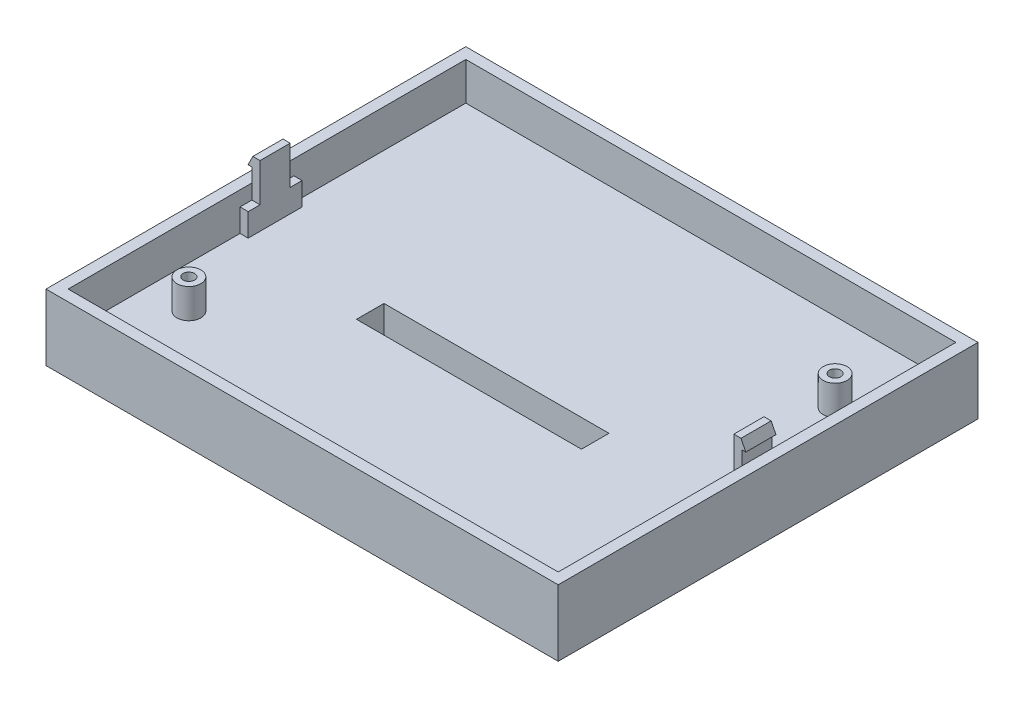
from build123d import *

# Parameters (mm, degrees)
SKETCH1_W           = 107
SKETCH1_H           = 87.7
BOSS_EXTRUDE1_DEPTH = 13.85
SKETCH2_W           = 102.38
SKETCH2_H           = 83.08
CUT_EXTRUDE1_DEPTH  = 7.9
SKETCH4_R           = 2.5
SKETCH4_R_2         = 1.2
BOSS_EXTRUDE2_DEPTH = 6.2
SKETCH7_W           = 11.25
SKETCH7_H           = 4.8
BOSS_EXTRUDE3_DEPTH = 1.7
BOSS_EXTRUDE4_DEPTH = 3.15
SKETCH3_W           = 23.5
SKETCH3_H           = 11.494748732
BOSS_EXTRUDE5_DEPTH = 4
SKETCH9_W           = 7.388623973
SKETCH9_H           = 2
CUT_EXTRUDE2_DEPTH  = 91.572539989
SKETCH10_W          = 47
SKETCH10_H          = 5.747374366
CUT_EXTRUDE4_DEPTH  = 72.670321612
CHAMFER1_SIZE       = 2
BOSS_EXTRUDE7_DEPTH = 1.5


with BuildPart() as part:
    # Sketch1 → Boss-Extrude1 (new body)
    with BuildSketch(Plane(origin=(0, 0, 0), x_dir=(1, 0, 0), z_dir=(0, 1, 0))):
        Rectangle(SKETCH1_W, SKETCH1_H)
    extrude(amount=BOSS_EXTRUDE1_DEPTH)

    # Sketch2 → Cut-Extrude1 (cut)
    with BuildSketch(Plane(origin=(0, 13.85, 0), x_dir=(1, 0, 0), z_dir=(0, 1, 0))):
        Rectangle(SKETCH2_W, SKETCH2_H)
    extrude(amount=-CUT_EXTRUDE1_DEPTH, mode=Mode.SUBTRACT)

    # Sketch4 → Boss-Extrude2 (add)
    # profile 1 of 2: a face of its own
    with BuildSketch(Plane(origin=(0, 5.95, 0), x_dir=(1, 0, 0), z_dir=(0, 1, 0))):
        with Locations(Location((-42.5, -25, 0), (0, 0, 90))):
            Circle(SKETCH4_R)
        with Locations(Location((-42.5, -25, 0), (0, 0, 90))):
            Circle(SKETCH4_R_2, mode=Mode.SUBTRACT)
    # profile 2 of 2: a face of its own
    with BuildSketch(Plane(origin=(0, 5.95, 0), x_dir=(1, 0, 0), z_dir=(0, 1, 0))):
        with Locations(Location((42.5, 25, 0), (0, 0, 90))):
            Circle(SKETCH4_R)
        with Locations(Location((42.5, 25, 0), (0, 0, 90))):
            Circle(SKETCH4_R_2, mode=Mode.SUBTRACT)
    extrude(amount=BOSS_EXTRUDE2_DEPTH)

    # Sketch7 → Boss-Extrude3 (add)
    with BuildSketch(Plane(origin=(-51.19, 0, 0), x_dir=(0, 0, -1), z_dir=(1, 0, 0))):
        with Locations((0, 8.35)):
            Rectangle(SKETCH7_W, SKETCH7_H)
    boss_extrude3 = extrude(amount=BOSS_EXTRUDE3_DEPTH)

    # Sketch8 → Boss-Extrude4 (add, symmetric)
    with BuildSketch(Plane.XY):
        Polygon((-49.49, 10.75), (-49.49, 18.75), (-50.99, 18.75), (-51.99, 16.75), (-51.19, 16.75), (-51.19, 10.75), align=None)
    boss_extrude4 = extrude(amount=BOSS_EXTRUDE4_DEPTH, both=True)

    # Sketch3 → Boss-Extrude5 (add)
    with BuildSketch(Plane.XZ):
        with Locations((-11.75, 8.992625634)):
            Rectangle(SKETCH3_W, SKETCH3_H)
        with Locations((11.75, 8.992625634)):
            Rectangle(SKETCH3_W, SKETCH3_H)
    extrude(amount=BOSS_EXTRUDE5_DEPTH)

    # Sketch9 → Cut-Extrude2 (cut, through all)
    with BuildSketch(Plane.ZY.offset(23.5)):
        with Locations((6.939563255, -1)):
            Rectangle(SKETCH9_W, SKETCH9_H)
    extrude(amount=-CUT_EXTRUDE2_DEPTH, mode=Mode.SUBTRACT)

    # Sketch10 → Cut-Extrude4 (cut, through all)
    with BuildSketch(Plane.XZ):
        with Locations((0, 6.118938451)):
            Rectangle(SKETCH10_W, SKETCH10_H)
    extrude(amount=-CUT_EXTRUDE4_DEPTH, mode=Mode.SUBTRACT)

    # Chamfer1
    chamfer1_edges = [part.edges().sort_by_distance(p)[0] for p in [
        (0, -2, 3.245251268),
    ]]
    chamfer(chamfer1_edges, length=CHAMFER1_SIZE - 0.0001)  # a hair under: the kernel refuses the full size

    # Mirror1: Boss-Extrude3, Boss-Extrude4 across plane
    add(boss_extrude3.mirror(Plane(origin=(0, 0, 0), x_dir=(0, 0, 1), z_dir=(1, 0, 0))))
    add(boss_extrude4.mirror(Plane(origin=(0, 0, 0), x_dir=(0, 0, 1), z_dir=(1, 0, 0))))

    # Sketch14 → Boss-Extrude7 (add)
    with BuildSketch(Plane.XZ):
        Polygon((-41.618061396, -23.418064695), (-46.893526608, -23.418064695), (-46.893526608, 0), (-35.18449426, 0), (-35.18449426, 14.74), (-23.5, 14.74), (-23.5, 10.633875241), (-29.707757231, 10.633875241), (-29.707757231, -4.071607842), (-41.618061396, -4.071607842), align=None)
    boss_extrude7 = extrude(amount=BOSS_EXTRUDE7_DEPTH)

    # Mirror2: Boss-Extrude7 across plane
    add(boss_extrude7.mirror(Plane(origin=(0, 0, 0), x_dir=(0, 0, 1), z_dir=(1, 0, 0))))


solid = part.part
